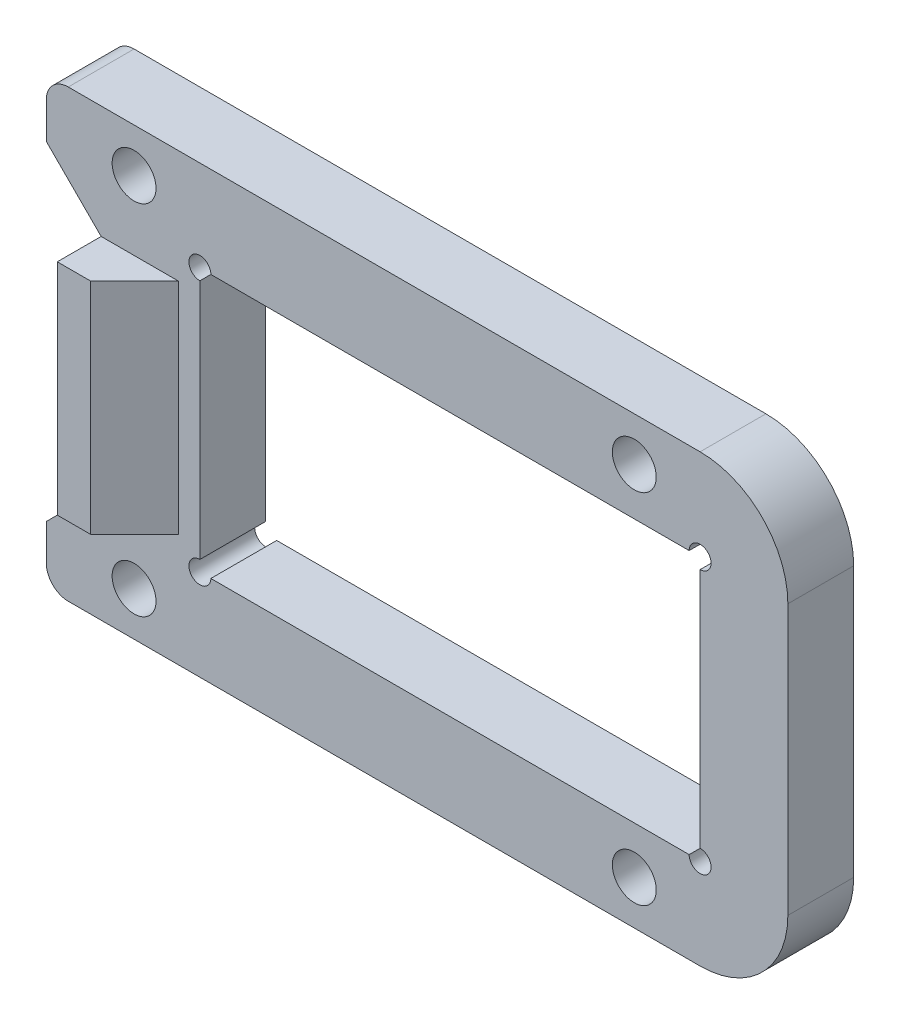
from build123d import *

# Parameters (mm, degrees)
SKETCH2_R           = 1
BOSS_EXTRUDE1_DEPTH = 3
SKETCH3_W           = 3.515258844
SKETCH3_H           = 10
BOSS_EXTRUDE2_DEPTH = 2
CHAMFER1_SIZE       = 2
FILLET1_R           = 4
FILLET2_R           = 1
CUT_EXTRUDE1_DEPTH  = 4


with BuildPart() as part:
    # Sketch2 → Boss-Extrude1 (new body)
    with BuildSketch(Plane.XY):
        with BuildLine():
            Line((47.48595993, 0.792979965), (51.48595993, 0.792979965))
            Line((51.48595993, 0.792979965), (51.48595993, 10.942979965))
            Line((51.48595993, 10.942979965), (17.68595993, 10.942979965))
            Line((17.68595993, 10.942979965), (17.68595993, 0.792979965))
            Line((17.68595993, 0.792979965), (24.68595993, 0.792979965))
            Line((24.68595993, 0.792979965), (24.68595993, 6.292979965))
            ThreePointArc((24.68595993, 6.292979965), (24.33240654, 7.146533356), (25.18595993, 6.792979965))
            Line((25.18595993, 6.792979965), (46.98595993, 6.792979965))
            ThreePointArc((46.98595993, 6.792979965), (47.839513321, 7.146533356), (47.48595993, 6.292979965))
            Line((47.48595993, 6.292979965), (47.48595993, 0.792979965))
        make_face()
        with Locations((44.48595993, 8.942979965)):
            Circle(SKETCH2_R, mode=Mode.SUBTRACT)
        with Locations((21.68595993, 8.942979965)):
            Circle(SKETCH2_R, mode=Mode.SUBTRACT)
    extrude(amount=BOSS_EXTRUDE1_DEPTH)

    # Mirror1: part across plane


with BuildPart() as part_1:
    add(part.part)
    add(part.part.mirror(Plane(origin=(0, 0.792979965, 3), x_dir=(0, 0, 1), z_dir=(0, -1, 0))))

    # Sketch3 → Boss-Extrude2 (add)
    with BuildSketch(Plane.XY.offset(3)):
        with Locations((21.943589352, 0.792979965)):
            Rectangle(SKETCH3_W, SKETCH3_H)
    extrude(amount=BOSS_EXTRUDE2_DEPTH)

    # Chamfer1
    chamfer1_edges = [part_1.edges().sort_by_distance(p)[0] for p in [
        (23.701218774, 0.792979965, 5),
    ]]
    chamfer(chamfer1_edges, length=CHAMFER1_SIZE - 0.0001)  # a hair under: the kernel refuses the full size

    # Fillet1
    fillet1_edges = [part_1.edges().sort_by_distance(p)[0] for p in [
        (51.48595993, 10.942979965, 1.5),
        (51.48595993, -9.357020035, 1.5),
    ]]
    fillet(fillet1_edges, radius=FILLET1_R)

    # Fillet2
    fillet2_edges = [part_1.edges().sort_by_distance(p)[0] for p in [
        (17.68595993, 10.942979965, 1.5),
        (17.68595993, -9.357020035, 1.5),
    ]]
    fillet(fillet2_edges, radius=FILLET2_R)

    # Sketch4 → Cut-Extrude1 (cut)
    with BuildSketch(Plane.XY.offset(3)):
        Polygon((20.18595993, -4.207020035), (17.68595993, -6.707020035), (17.68595993, 8.292979965), (20.18595993, 5.792979965), align=None)
    extrude(amount=-CUT_EXTRUDE1_DEPTH, mode=Mode.SUBTRACT)


solid = part_1.part
